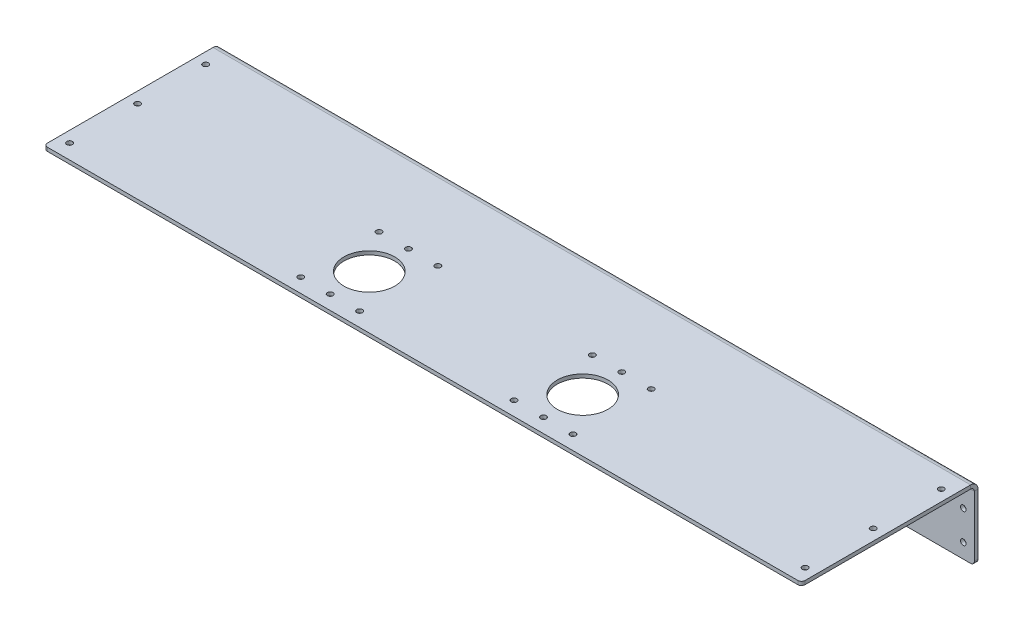
from build123d import *

# Parameters (mm, degrees)
BASE_FLANGE1_DEPTH = 654.05
SKETCH6_R          = 21.9075
CUT_EXTRUDE1_DEPTH = 3.175
SKETCH7_R          = 2.4257
CUT_EXTRUDE2_DEPTH = 683.89076222
SKETCH8_R          = 2.4257
CUT_EXTRUDE3_DEPTH = 683.89076222
SKETCH9_R          = 2.4257
CUT_EXTRUDE4_DEPTH = 683.89076222
FILLET1_R          = 3.175
SKETCH10_W         = 152.4
SKETCH10_H         = 61.9125
CUT_EXTRUDE5_DEPTH = 683.89076222
FILLET2_R          = 3.175


# Sheet-metal steps are written as plain solids
with BuildPart() as part:
    # Sketch1 → Base-Flange1 (new body)
    with BuildSketch(Plane(origin=(0, 0, 0), x_dir=(0, 0, -1), z_dir=(1, 0, 0))):
        with BuildLine():
            Line((0, 0), (146.05, 0))
            ThreePointArc((146.05, 0), (150.540128061, 1.859871939), (152.4, 6.35))
            Line((152.4, 6.35), (152.4, 117.475))
            ThreePointArc((152.4, 117.475), (150.540128061, 121.965128061), (146.05, 123.825))
            Line((146.05, 123.825), (0, 123.825))
            Line((0, 123.825), (0, 120.65))
            Line((0, 120.65), (146.05, 120.65))
            ThreePointArc((146.05, 120.65), (148.29506403, 119.72006403), (149.225, 117.475))
            Line((149.225, 117.475), (149.225, 6.35))
            ThreePointArc((149.225, 6.35), (148.29506403, 4.10493597), (146.05, 3.175))
            Line((146.05, 3.175), (0, 3.175))
            Line((0, 3.175), (0, 0))
        make_face()
    extrude(amount=BASE_FLANGE1_DEPTH)

    # Sketch6 → Cut-Extrude1 (cut)
    with BuildSketch(Plane(origin=(0, 123.825, 0), x_dir=(1, 0, 0), z_dir=(0, 1, 0))):
        with Locations(Location((234.95, 46.0375, 0), (0, 0, 270))):
            Circle(SKETCH6_R)
    cut_extrude1 = extrude(amount=-CUT_EXTRUDE1_DEPTH, mode=Mode.SUBTRACT)

    # Sketch7 → Cut-Extrude2 (cut, through all)
    with BuildSketch(Plane(origin=(0, 123.825, 0), x_dir=(1, 0, 0), z_dir=(0, 1, 0))):
        with Locations(Location((234.95, 12.2555, 0), (0, 0, 270))):
            Circle(SKETCH7_R)
        with Locations(Location((234.95, 79.8195, 0), (0, 0, 270))):
            Circle(SKETCH7_R)
        with Locations(Location((209.55, 12.2555, 0), (0, 0, 270))):
            Circle(SKETCH7_R)
        with Locations(Location((260.35, 12.2555, 0), (0, 0, 270))):
            Circle(SKETCH7_R)
        with Locations(Location((260.35, 79.8195, 0), (0, 0, 270))):
            Circle(SKETCH7_R)
        with Locations(Location((209.55, 79.8195, 0), (0, 0, 270))):
            Circle(SKETCH7_R)
    cut_extrude2 = extrude(amount=-CUT_EXTRUDE2_DEPTH, mode=Mode.SUBTRACT)

    # Sketch8 → Cut-Extrude3 (cut, through all)
    with BuildSketch(Plane(origin=(0, 123.825, 0), x_dir=(1, 0, 0), z_dir=(0, 1, 0))):
        with Locations(Location((644.525, 12.7, 0), (0, 0, 270))):
            Circle(SKETCH8_R)
        with Locations(Location((644.525, 71.4375, 0), (0, 0, 270))):
            Circle(SKETCH8_R)
        with Locations(Location((644.525, 130.175, 0), (0, 0, 270))):
            Circle(SKETCH8_R)
        with Locations(Location((9.525, 130.175, 0), (0, 0, 270))):
            Circle(SKETCH8_R)
        with Locations(Location((9.525, 71.4375, 0), (0, 0, 270))):
            Circle(SKETCH8_R)
        with Locations(Location((9.525, 12.7, 0), (0, 0, 270))):
            Circle(SKETCH8_R)
    extrude(amount=-CUT_EXTRUDE3_DEPTH, mode=Mode.SUBTRACT)

    # Sketch9 → Cut-Extrude4 (cut, through all)
    with BuildSketch(Plane(origin=(0, 0, -152.4), x_dir=(-1, 0, 0), z_dir=(0, 0, -1))):
        with Locations((-644.525, 74.6125)):
            Circle(SKETCH9_R)
        with Locations((-644.525, 49.2125)):
            Circle(SKETCH9_R)
        with Locations((-9.525, 49.2125)):
            Circle(SKETCH9_R)
        with Locations((-9.525, 74.6125)):
            Circle(SKETCH9_R)
        with Locations((-644.525, 100.0125)):
            Circle(SKETCH9_R)
        with Locations((-644.525, 23.8125)):
            Circle(SKETCH9_R)
        with Locations((-9.525, 23.8125)):
            Circle(SKETCH9_R)
        with Locations((-9.525, 100.0125)):
            Circle(SKETCH9_R)
    extrude(amount=-CUT_EXTRUDE4_DEPTH, mode=Mode.SUBTRACT)

    # Fillet1
    fillet1_edges = [part.edges().sort_by_distance(p)[0] for p in [
        (0, 1.5875, 0),
        (0, 122.2375, 0),
        (654.05, 1.5875, 0),
        (654.05, 122.2375, 0),
    ]]
    fillet(fillet1_edges, radius=FILLET1_R)

    # Sketch10 → Cut-Extrude5 (cut, through all)
    with BuildSketch(Plane(origin=(654.05, 0, 0), x_dir=(0, 0, -1), z_dir=(1, 0, 0))):
        with Locations((76.2, 30.95625)):
            Rectangle(SKETCH10_W, SKETCH10_H)
    extrude(amount=-CUT_EXTRUDE5_DEPTH, mode=Mode.SUBTRACT)

    # Fillet2
    fillet2_edges = [part.edges().sort_by_distance(p)[0] for p in [
        (654.05, 61.9125, -150.8125),
        (0, 61.9125, -150.8125),
    ]]
    fillet(fillet2_edges, radius=FILLET2_R)

    # Mirror1: Cut-Extrude1, Cut-Extrude2 across plane
    add(cut_extrude1.mirror(Plane.ZY.offset(-327.025)), mode=Mode.SUBTRACT)
    add(cut_extrude2.mirror(Plane.ZY.offset(-327.025)), mode=Mode.SUBTRACT)


solid = part.part
